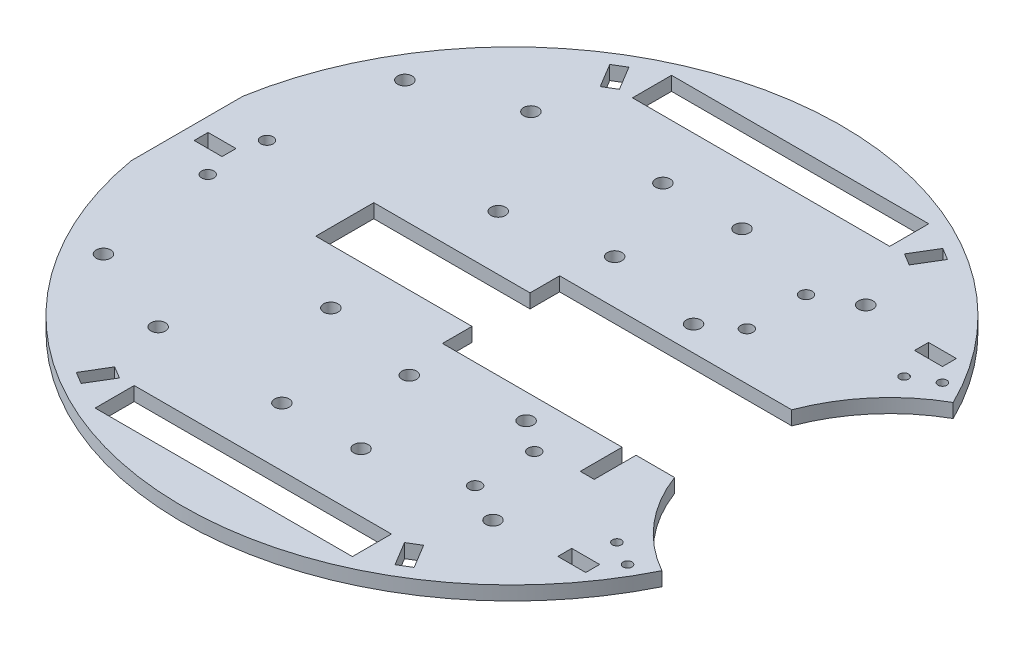
from build123d import *

# Parameters (mm, degrees)
SKETCH1_R           = 1.397
SKETCH1_R_2         = 1.651
SKETCH1_R_3         = 1.016
SKETCH1_W           = 58.544107304
SKETCH1_H           = 8.89
SKETCH1_W_2         = 6.35
SKETCH1_H_2         = 3.175
BOSS_EXTRUDE1_DEPTH = 3.175


with BuildPart() as part:
    # Sketch1 → Boss-Extrude1 (new body)
    with BuildSketch(Plane(origin=(0, 0, 0), x_dir=(1, 0, 0), z_dir=(0, 1, 0))):
        with BuildLine():
            Line((38.407265908, 13.335), (41.582265908, 13.335))
            Line((41.582265908, 13.335), (50.342102347, 13.335))
            ThreePointArc((50.342102347, 13.335), (57.058059725, 24.74076345), (67.270928268, 33.160552015))
            ThreePointArc((67.270928268, 33.160552015), (-10.756431789, 74.224653419), (-73.916912814, 12.7))
            Line((-73.916912814, 12.7), (-73.916912814, -12.7))
            ThreePointArc((-73.916912814, -12.7), (-10.756431789, -74.224653419), (67.270928268, -33.160552015))
            ThreePointArc((67.270928268, -33.160552015), (60.584216496, -28.355013333), (55.086193863, -22.225))
            ThreePointArc((55.086193863, -22.225), (52.41895011, -17.937530518), (50.342102347, -13.335))
            Line((50.342102347, -13.335), (46.281265908, -13.335))
            Line((46.281265908, -13.335), (41.582265908, -13.335))
            Line((41.582265908, -13.335), (41.582265908, -22.86))
            Line((41.582265908, -22.86), (38.407265908, -22.86))
            Line((38.407265908, -22.86), (38.407265908, -13.335))
            Line((38.407265908, -13.335), (-2.486734092, -13.335))
            Line((-2.486734092, -13.335), (-2.486734092, -6.604))
            Line((-2.486734092, -6.604), (-38.046734092, -6.604))
            Line((-38.046734092, -6.604), (-38.046734092, 6.604))
            Line((-38.046734092, 6.604), (-2.486734092, 6.604))
            Line((-2.486734092, 6.604), (-2.486734092, 13.335))
            Line((-2.486734092, 13.335), (38.407265908, 13.335))
        make_face()
        with Locations((-62.486912814, 6.731)):
            Circle(SKETCH1_R, mode=Mode.SUBTRACT)
        with Locations((-62.486912814, -6.731)):
            Circle(SKETCH1_R, mode=Mode.SUBTRACT)
        with Locations((-38.1, -42.418)):
            Circle(SKETCH1_R_2, mode=Mode.SUBTRACT)
        with Locations((38.1, -42.418)):
            Circle(SKETCH1_R_2, mode=Mode.SUBTRACT)
        with Locations((38.1, 42.418)):
            Circle(SKETCH1_R_2, mode=Mode.SUBTRACT)
        with Locations((0, -23.368)):
            Circle(SKETCH1_R_2, mode=Mode.SUBTRACT)
        with Locations((-38.1, 42.418)):
            Circle(SKETCH1_R_2, mode=Mode.SUBTRACT)
        with Locations((0, 23.368)):
            Circle(SKETCH1_R_2, mode=Mode.SUBTRACT)
        with Locations((29.272053652, -37.649461806)):
            Circle(SKETCH1_R, mode=Mode.SUBTRACT)
        with Locations((-58.676912814, 34.29)):
            Circle(SKETCH1_R_2, mode=Mode.SUBTRACT)
        with Locations((62.141053559, -35.830642926)):
            Circle(SKETCH1_R_3, mode=Mode.SUBTRACT)
        with Locations((56.570777105, -32.679132142)):
            Circle(SKETCH1_R_3, mode=Mode.SUBTRACT)
        with Locations((-58.676912814, -34.29)):
            Circle(SKETCH1_R_2, mode=Mode.SUBTRACT)
        with Locations((29.272053652, -24.187461806)):
            Circle(SKETCH1_R, mode=Mode.SUBTRACT)
        with Locations((29.272053652, 37.649461806)):
            Circle(SKETCH1_R, mode=Mode.SUBTRACT)
        with Locations((29.272053652, 24.187461806)):
            Circle(SKETCH1_R, mode=Mode.SUBTRACT)
        with Locations((8.99925, -43.353461806)):
            Circle(SKETCH1_R_2, mode=Mode.SUBTRACT)
        with Locations((-9.00075, -43.353461806)):
            Circle(SKETCH1_R_2, mode=Mode.SUBTRACT)
        with Locations((-9.00075, 43.353461806)):
            Circle(SKETCH1_R_2, mode=Mode.SUBTRACT)
        with Locations((8.99925, 43.353461806)):
            Circle(SKETCH1_R_2, mode=Mode.SUBTRACT)
        with Locations((62.141053559, 35.830642926)):
            Circle(SKETCH1_R_3, mode=Mode.SUBTRACT)
        with Locations((56.570777105, 32.679132142)):
            Circle(SKETCH1_R_3, mode=Mode.SUBTRACT)
        with Locations((22.278265908, 19.05)):
            Circle(SKETCH1_R_2, mode=Mode.SUBTRACT)
        with Locations((22.278265908, -19.05)):
            Circle(SKETCH1_R_2, mode=Mode.SUBTRACT)
        with Locations((-22.171734092, -19.05)):
            Circle(SKETCH1_R_2, mode=Mode.SUBTRACT)
        with Locations((-22.171734092, 19.05)):
            Circle(SKETCH1_R_2, mode=Mode.SUBTRACT)
        with Locations((0, -61.144461806)):
            Rectangle(SKETCH1_W, SKETCH1_H, mode=Mode.SUBTRACT)
        with Locations((0, 61.144461806)):
            Rectangle(SKETCH1_W, SKETCH1_H, mode=Mode.SUBTRACT)
        with Locations((55.791053559, -40.593142926)):
            Rectangle(SKETCH1_W_2, SKETCH1_H_2, mode=Mode.SUBTRACT)
        with Locations((55.791053559, 40.593142926)):
            Rectangle(SKETCH1_W_2, SKETCH1_H_2, mode=Mode.SUBTRACT)
        Polygon((32.44100721, -56.895314679), (35.719111901, -62.333745485), (38.438327304, -60.694693139), (35.160222613, -55.256262334), align=None, mode=Mode.SUBTRACT)
        Polygon((-32.44100721, -56.895314679), (-35.160222613, -55.256262334), (-38.438327304, -60.694693139), (-35.719111901, -62.333745485), align=None, mode=Mode.SUBTRACT)
        Polygon((-35.160222613, 55.256262334), (-38.438327304, 60.694693139), (-35.719111901, 62.333745485), (-32.44100721, 56.895314679), align=None, mode=Mode.SUBTRACT)
        Polygon((35.160222613, 55.256262334), (38.438327304, 60.694693139), (35.719111901, 62.333745485), (32.44100721, 56.895314679), align=None, mode=Mode.SUBTRACT)
        with Locations((-67.566912814, 0)):
            Rectangle(SKETCH1_W_2, SKETCH1_H_2, mode=Mode.SUBTRACT)
    extrude(amount=BOSS_EXTRUDE1_DEPTH)


solid = part.part
